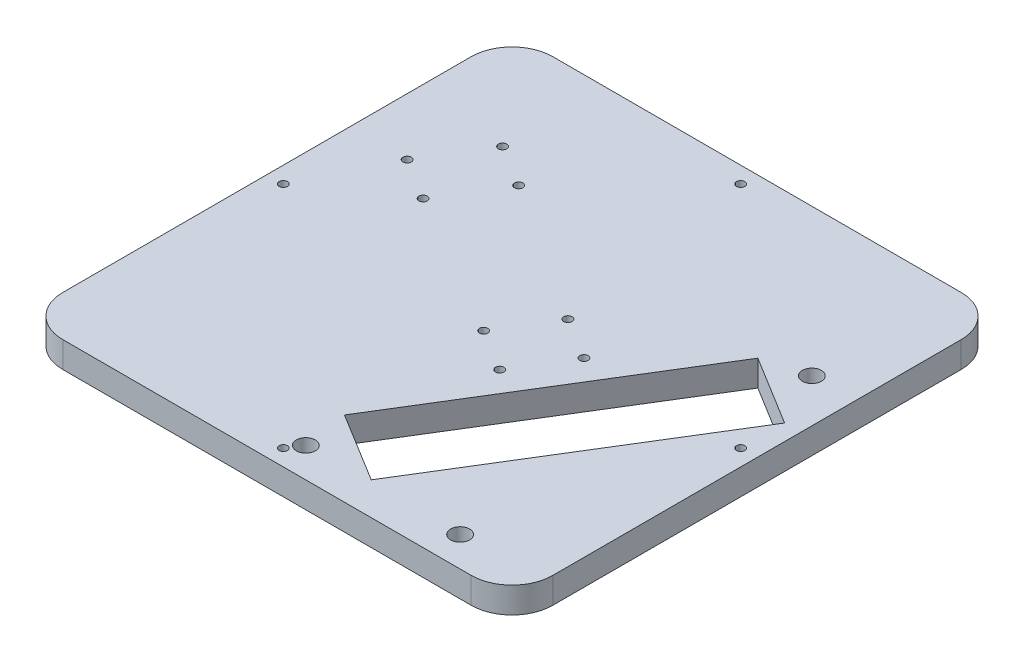
from build123d import *

# Parameters (mm, degrees)
BOSS_EXTRUDE1_DEPTH = 6.35
SKETCH2_R           = 2.325
CUT_EXTRUDE1_DEPTH  = 170.824387236
SKETCH5_R           = 1.025
CUT_EXTRUDE2_DEPTH  = 170.824387236


with BuildPart() as part:
    # Sketch1 → Boss-Extrude1 (new body)
    with BuildSketch(Plane(origin=(0, 0, 0), x_dir=(1, 0, 0), z_dir=(0, 1, 0))):
        with BuildLine():
            Line((10, 0), (110, 0))
            ThreePointArc((110, 0), (117.071067812, 2.928932188), (120, 10))
            Line((120, 10), (120, 110))
            ThreePointArc((120, 110), (117.071067812, 117.071067812), (110, 120))
            Line((110, 120), (10, 120))
            ThreePointArc((10, 120), (2.928932188, 117.071067812), (0, 110))
            Line((0, 110), (0, 10))
            ThreePointArc((0, 10), (2.928932188, 2.928932188), (10, 0))
        make_face()
    extrude(amount=BOSS_EXTRUDE1_DEPTH)

    # Sketch2 → Cut-Extrude1 (cut, through all)
    with BuildSketch(Plane(origin=(0, 6.35, 0), x_dir=(1, 0, 0), z_dir=(0, 1, 0))):
        with Locations((62.192235265, 7.325)):
            Circle(SKETCH2_R)
        with Locations((99.974668934, 7.325)):
            Circle(SKETCH2_R)
        with Locations((109.393095317, 84.031927265)):
            Circle(SKETCH2_R)
        Polygon((60.471691743, 18.506055104), (77.505195351, 8.02465468), (116.066267511, 70.690914453), (99.032763904, 81.172314877), align=None)
    extrude(amount=-CUT_EXTRUDE1_DEPTH, mode=Mode.SUBTRACT)

    # Sketch5 → Cut-Extrude2 (cut, through all)
    with BuildSketch(Plane(origin=(0, 6.35, 0), x_dir=(1, 0, 0), z_dir=(0, 1, 0))):
        with Locations((69.859976402, 47.120111286)):
            Circle(SKETCH5_R)
        with Locations((59.639874237, 53.408951541)):
            Circle(SKETCH5_R)
        with Locations((77.72102672, 59.895238992)):
            Circle(SKETCH5_R)
        with Locations((67.500924556, 66.184079246)):
            Circle(SKETCH5_R)
        with Locations((13.977019656, 80.332987484)):
            Circle(SKETCH5_R)
        with Locations((24.197121821, 74.04414723)):
            Circle(SKETCH5_R)
        with Locations((33.106312181, 88.522625296)):
            Circle(SKETCH5_R)
        with Locations((22.886210017, 94.811465551)):
            Circle(SKETCH5_R)
        with Locations((60, 116)):
            Circle(SKETCH5_R)
        with Locations((60, 4)):
            Circle(SKETCH5_R)
        with Locations((4, 60)):
            Circle(SKETCH5_R)
        with Locations((116, 60)):
            Circle(SKETCH5_R)
    extrude(amount=-CUT_EXTRUDE2_DEPTH, mode=Mode.SUBTRACT)


solid = part.part
